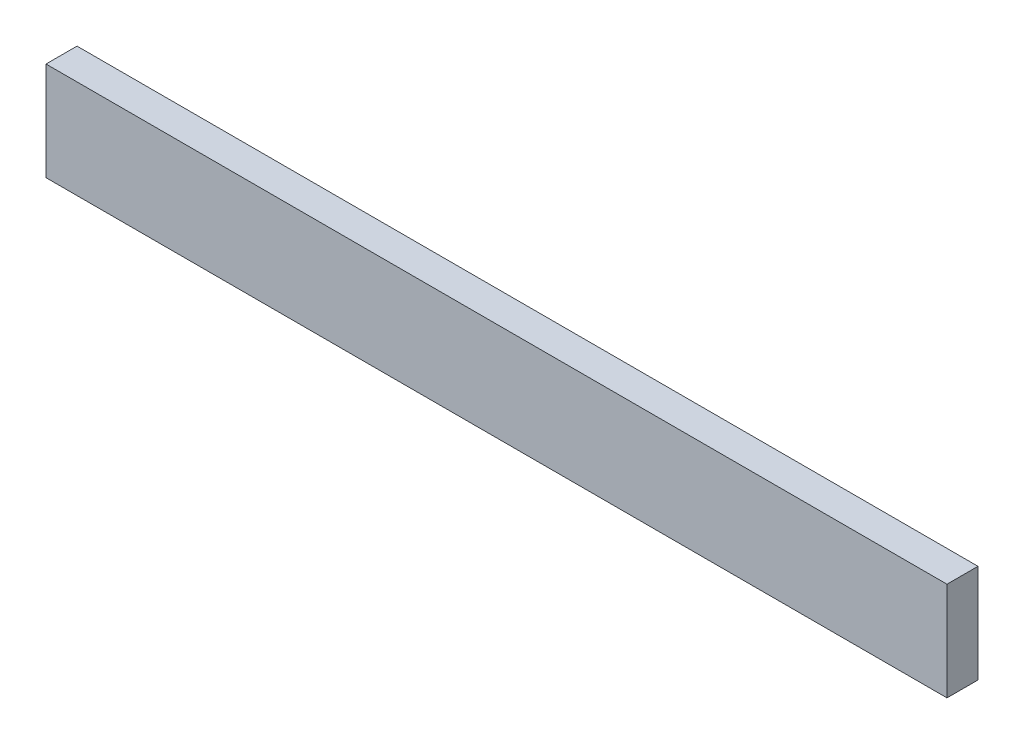
from build123d import *

# Parameters (mm, degrees)
SKETCH1_W           = 46.482
SKETCH1_H           = 5.08
BOSS_EXTRUDE1_DEPTH = 1.6


with BuildPart() as part:
    # Sketch1 → Boss-Extrude1 (new body)
    with BuildSketch(Plane.XY):
        Rectangle(SKETCH1_W, SKETCH1_H)
    extrude(amount=BOSS_EXTRUDE1_DEPTH)


solid = part.part
